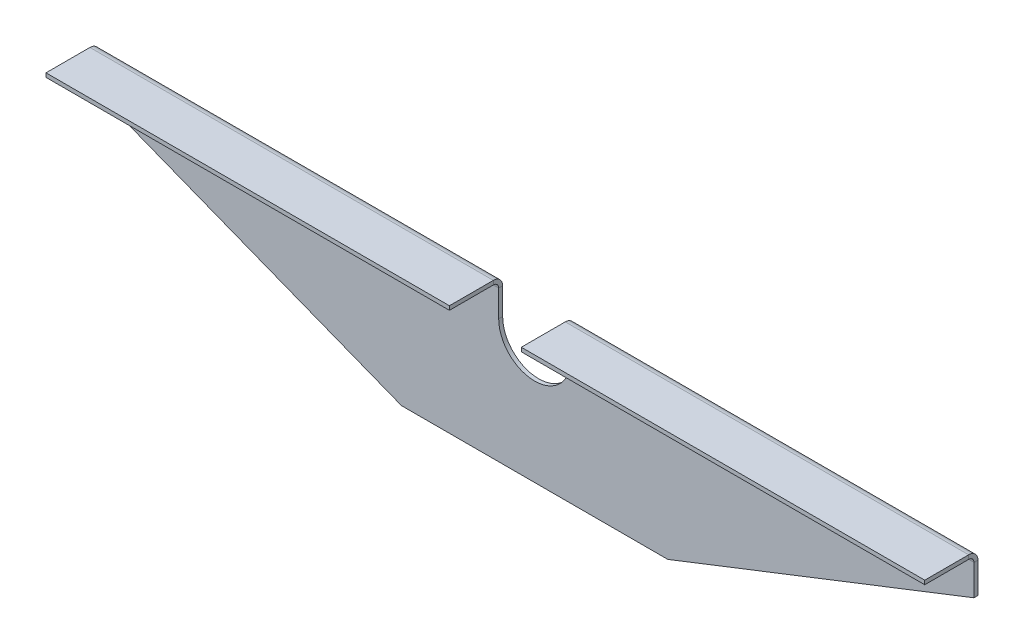
from build123d import *

# Parameters (mm, degrees)
BASE_FLANGE2_DEPTH           = 1.5
EDGE_FLANGE1_STRIP_W         = 10
EDGE_FLANGE1_STRIP_H         = 1.5
EDGE_FLANGE1_STRIP_CUT_DEPTH = 330
EDGE_FLANGE1_DEPTH           = 330
CUT_EXTRUDE1_DEPTH           = 174.399106111
CUT_EXTRUDE1_DEPTH_BACK      = 10


# Sheet-metal steps are written as plain solids
with BuildPart() as part:
    # Sketch1 → Base-Flange2 (new body)
    with BuildSketch(Plane.XY):
        Polygon((-165, 10), (165, 10), (165, -5), (50, -50), (-50, -50), (-165, -5), align=None)
    extrude(amount=-BASE_FLANGE2_DEPTH)

    # Edge-Flange1 strip (across the edge) → Edge-Flange1 strip cut (cut)
    with BuildSketch(Plane(origin=(165, 10, 0), x_dir=(0, -1, 0), z_dir=(-1, 0, 0))):
        with Locations((-1.5, -0.75)):
            Rectangle(EDGE_FLANGE1_STRIP_W, EDGE_FLANGE1_STRIP_H)
    extrude(amount=EDGE_FLANGE1_STRIP_CUT_DEPTH, mode=Mode.SUBTRACT)

    # Edge-Flange1 section (across the edge) → Edge-Flange1 (add)
    with BuildSketch(Plane(origin=(165, 10, 0), x_dir=(0, -1, 0), z_dir=(-1, 0, 0))):
        with BuildLine():
            Line((0, 2), (0, 18.5))
            Line((0, 18.5), (1.5, 18.5))
            Line((1.5, 18.5), (1.5, 2))
            ThreePointArc((1.5, 2), (2.085786438, 0.585786438), (3.5, 0))
            Line((3.5, 0), (3.5, -1.5))
            ThreePointArc((3.5, -1.5), (1.025126266, -0.474873734), (0, 2))
        make_face()
    extrude(amount=EDGE_FLANGE1_DEPTH)

    # Sketch13 → Cut-Extrude1 (cut, two sides: drawn at the far end of the back side and taken through both)
    with BuildSketch(Plane.XY.offset(-CUT_EXTRUDE1_DEPTH_BACK)):
        with BuildLine():
            Line((-13.5, -3.5), (-13.5, 21.0126417))
            Line((-13.5, 21.0126417), (13.5, 21.0126417))
            Line((13.5, 21.0126417), (13.5, -3.5))
            ThreePointArc((13.5, -3.5), (0, -17), (-13.5, -3.5))
        make_face()
    extrude(amount=CUT_EXTRUDE1_DEPTH + CUT_EXTRUDE1_DEPTH_BACK, mode=Mode.SUBTRACT)


solid = part.part
